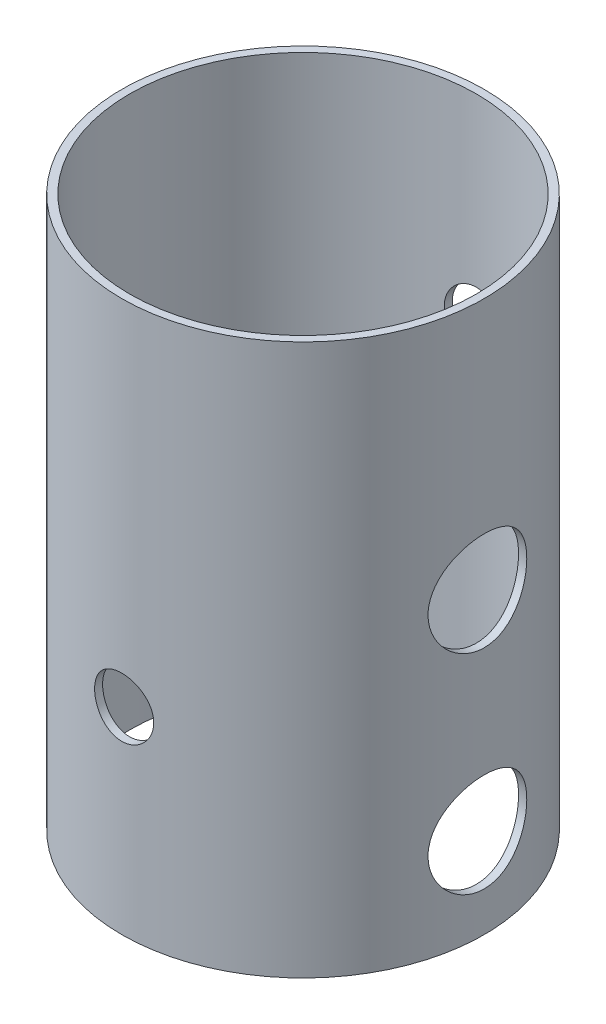
from build123d import *

# Parameters (mm, degrees)
SKETCH1_R           = 46
SKETCH1_R_2         = 44
BOSS_EXTRUDE1_DEPTH = 139.8
SKETCH2_R           = 12.53
CUT_EXTRUDE1_DEPTH  = 155.194811845
SKETCH4_R           = 7.5
CUT_EXTRUDE2_DEPTH  = 155.194811996
SKETCH5_R           = 7.5
CUT_EXTRUDE3_DEPTH  = 155.194811996


with BuildPart() as part:
    # Sketch1 → Boss-Extrude1 (new body)
    with BuildSketch(Plane(origin=(0, 0, 0), x_dir=(1, 0, 0), z_dir=(0, 1, 0))):
        Circle(SKETCH1_R)
        Circle(SKETCH1_R_2, mode=Mode.SUBTRACT)
    extrude(amount=BOSS_EXTRUDE1_DEPTH)

    # Sketch2 → Cut-Extrude1 (cut, through all)
    with BuildSketch(Plane(origin=(0, 0, 0), x_dir=(0, 0, -1), z_dir=(1, 0, 0))):
        with Locations((0, 22.6)):
            Circle(SKETCH2_R)
        with Locations((0, 75.6)):
            Circle(SKETCH2_R)
    extrude(amount=CUT_EXTRUDE1_DEPTH, mode=Mode.SUBTRACT)

    # Sketch4 → Cut-Extrude2 (cut, through all)
    with BuildSketch(Plane.XY):
        with Locations((0, 50)):
            Circle(SKETCH4_R)
    extrude(amount=CUT_EXTRUDE2_DEPTH, mode=Mode.SUBTRACT)

    # Sketch5 → Cut-Extrude3 (cut, through all)
    with BuildSketch(Plane.XY):
        with Locations((0, 89.8)):
            Circle(SKETCH5_R)
    extrude(amount=-CUT_EXTRUDE3_DEPTH, mode=Mode.SUBTRACT)


solid = part.part
